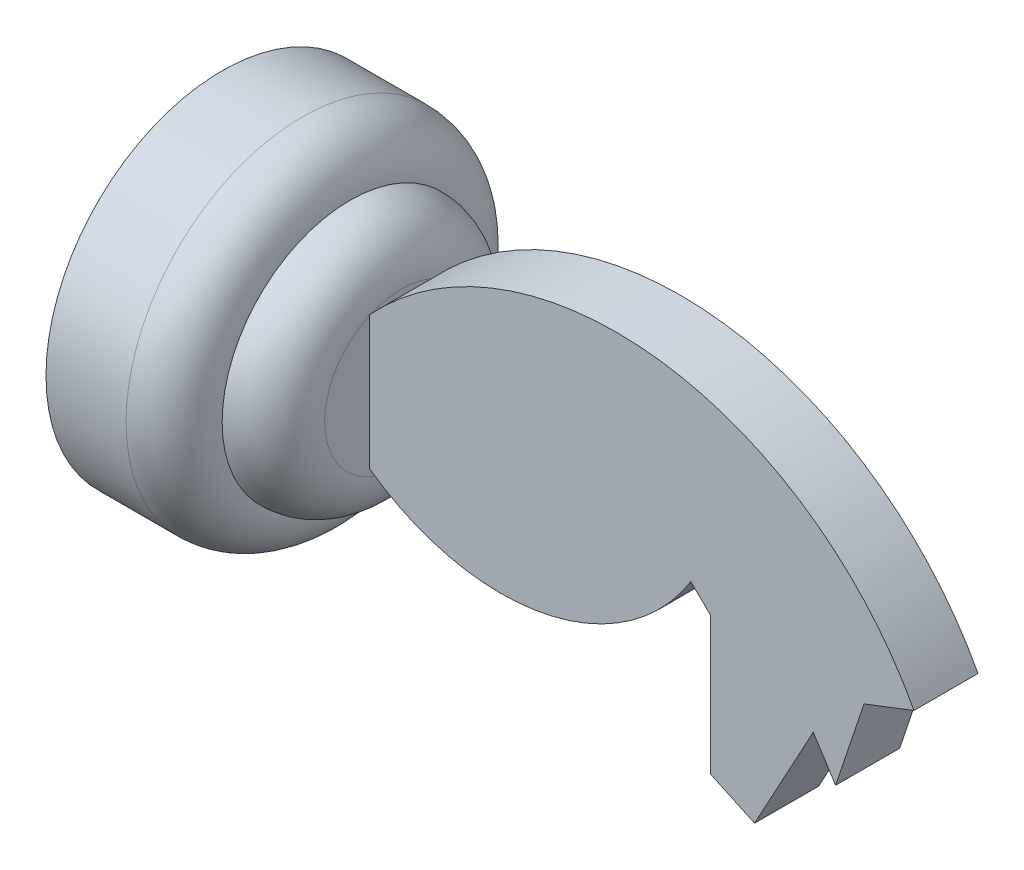
from build123d import *

# Parameters (mm, degrees)
EXTRUDE_2_DEPTH = 2


with BuildPart() as part:
    # Sketch 227 → Повернуть1 (revolve)
    with BuildSketch(Plane.XY):
        with BuildLine():
            Line((0, 11), (0, 0))
            Line((0, 0), (11.2, 0))
            Line((11.2, 0), (11.2, 4.8))
            ThreePointArc((11.2, 4.8), (10.2627417, 7.0627417), (8, 8))
            ThreePointArc((8, 8), (7.121320344, 10.121320344), (5, 11))
            Line((5, 11), (0, 11))
        make_face()
    revolve(axis=Axis((0, 0, 0), (1, 0, 0)))

    # Sketch 907 → Бобышка-Вытянуть2 (add, symmetric)
    with BuildSketch(Plane.XY):
        with BuildLine():
            Line((11.2, 4.4), (11.2, -3.914978255))
            ThreePointArc((11.2, -3.914978255), (22.080678837, -6.30816882), (31.263463773, 0))
            Line((31.263463773, 0), (32.498964702, -1.197255299))
            Line((32.498964702, -1.197255299), (32.498964702, -9.797255299))
            Line((32.498964702, -9.797255299), (35.248695767, -11.07))
            Line((35.248695767, -11.07), (38.912013935, -4.32))
            Line((38.912013935, -4.32), (40.307542508, -6.49))
            Line((40.307542508, -6.49), (42.083014277, -1.2))
            Line((42.083014277, -1.2), (45.2, 0))
            ThreePointArc((45.2, 0), (29.338267199, 10.995701086), (11.2, 4.4))
        make_face()
    extrude(amount=EXTRUDE_2_DEPTH, both=True)


solid = part.part
